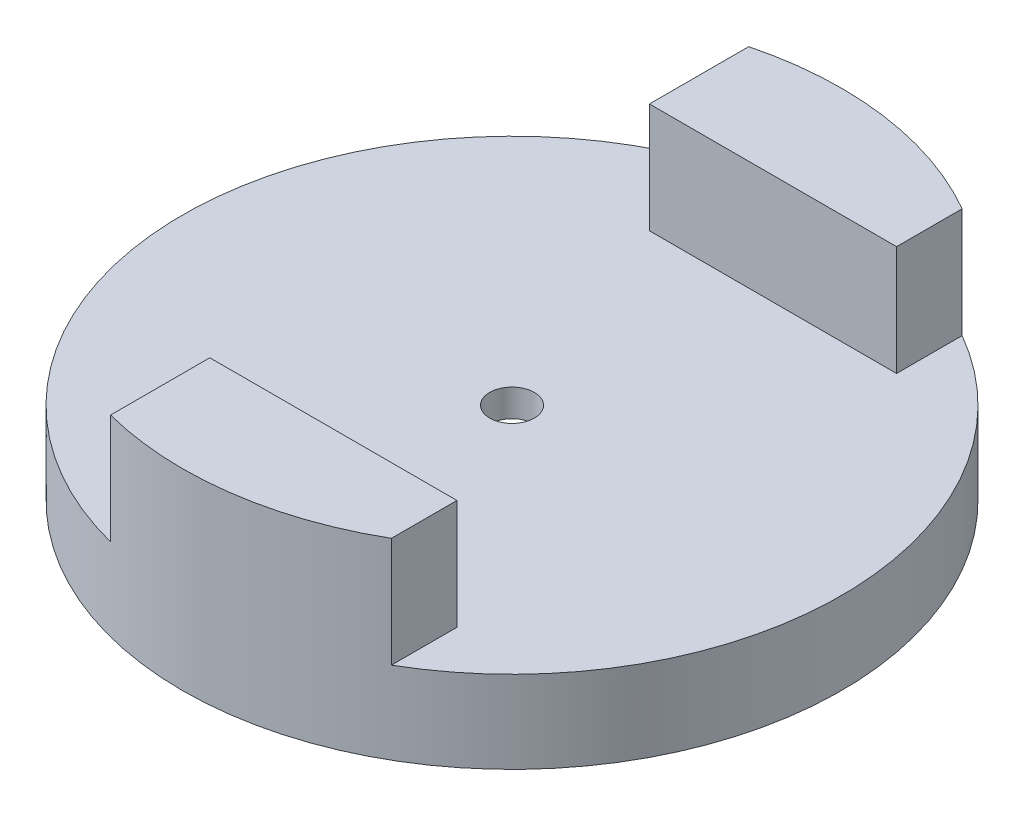
from build123d import *

# Parameters (mm, degrees)
SKETCH1_R                         = 5.159375
BOSS_EXTRUDE1_DEPTH               = 6.35
SKETCH1_3_R                       = 76.2
SKETCH1_3_R_2                     = 74.14006
BOSS_EXTRUDE2_DEPTH               = 19.05
BOSS_EXTRUDE3_START               = 25.4
BOSS_EXTRUDE3_DEPTH               = 25.4
PIPE_TAP_DRILL_FOR_3_8_TAP1_D     = 14.2748
PIPE_TAP_DRILL_FOR_3_8_TAP1_DEPTH = 30.48
PIPE_TAP_DRILL_FOR_3_8_TAP1_TIP   = 4.288582582


with BuildPart() as part:
    # Sketch1 → Boss-Extrude1 (new body)
    with BuildSketch(Plane(origin=(0, 0, 0), x_dir=(1, 0, 0), z_dir=(0, 1, 0))):
        with BuildLine():
            Line((38.1, -65.991135768), (38.1, -63.601403261))
            ThreePointArc((38.1, -63.601403261), (74.14006, 0), (38.1, 63.601403261))
            Line((38.1, 63.601403261), (38.1, 65.991135768))
            ThreePointArc((38.1, 65.991135768), (-76.2, 0), (38.1, -65.991135768))
        make_face()
        Circle(SKETCH1_R, mode=Mode.SUBTRACT)
    extrude(amount=-BOSS_EXTRUDE1_DEPTH)

    # Sketch1<3> → Boss-Extrude2 (add)
    with BuildSketch(Plane(origin=(0, 0, 0), x_dir=(1, 0, 0), z_dir=(0, 1, 0))):
        Circle(SKETCH1_3_R)
        Circle(SKETCH1_3_R_2, mode=Mode.SUBTRACT)
    extrude(amount=-BOSS_EXTRUDE2_DEPTH)

    # Sketch1<4> → Boss-Extrude3 (add)
    with BuildSketch(Plane(origin=(0, 0, 0), x_dir=(1, 0, 0), z_dir=(0, 1, 0)).offset(BOSS_EXTRUDE3_START)):
        with BuildLine():
            ThreePointArc((-19.05, -73.780332745), (10.290457832, -75.501963402), (38.1, -65.991135768))
            Line((38.1, -65.991135768), (38.1, -50.83048))
            Line((38.1, -50.83048), (-19.05, -50.83048))
            Line((-19.05, -50.83048), (-19.05, -73.780332745))
        make_face()
        with BuildLine():
            ThreePointArc((38.1, 65.991135768), (10.290457832, 75.501963402), (-19.05, 73.780332745))
            Line((-19.05, 73.780332745), (-19.05, 50.83048))
            Line((-19.05, 50.83048), (38.1, 50.83048))
            Line((38.1, 50.83048), (38.1, 65.991135768))
        make_face()
    extrude(amount=-BOSS_EXTRUDE3_DEPTH)

    # Pipe Tap Drill for 3/8 Tap1
    with Locations(Plane(origin=(-19.05, 12.7, -63.53048), x_dir=(0, 0, -1), z_dir=(-1, 0, 0))):
        with Locations((0, 0), (-127.06096, 0)):
            Hole(PIPE_TAP_DRILL_FOR_3_8_TAP1_D / 2, depth=PIPE_TAP_DRILL_FOR_3_8_TAP1_DEPTH)
            with Locations((0, 0, -(PIPE_TAP_DRILL_FOR_3_8_TAP1_DEPTH + PIPE_TAP_DRILL_FOR_3_8_TAP1_TIP / 2))):  # 118° drill point
                Cone(0, PIPE_TAP_DRILL_FOR_3_8_TAP1_D / 2, PIPE_TAP_DRILL_FOR_3_8_TAP1_TIP, mode=Mode.SUBTRACT)

    # Sketch5 → Cut-Revolve1 (revolve, cut)
    with BuildSketch(Plane.XY.offset(63.5)):
        Polygon((-0.586700011, 0.461233867), (-14.329937569, -9.010139134), (-9.851270305, -12.531040762), (8.731053995, 11.106100038), (8.144353984, 11.567333905), align=None)
    revolve(axis=Axis((-9.851270305, -12.531040762, 63.5), (0.6180330327976165, 0.7861521292796836, 0)), mode=Mode.SUBTRACT)


solid = part.part
